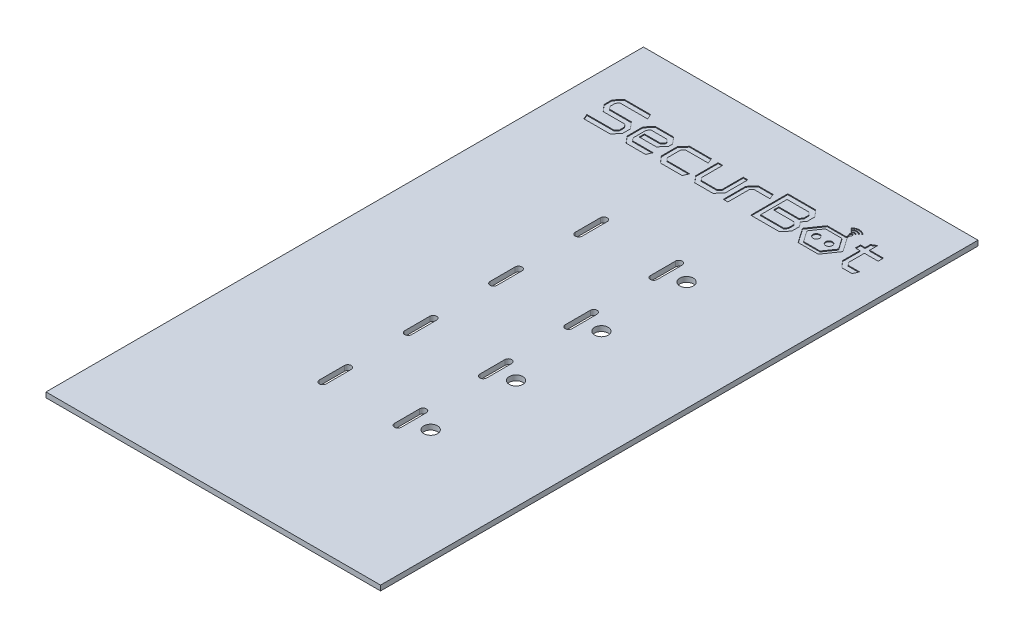
from build123d import *

# Parameters (mm, degrees)
SKETCH1_W                 = 196
SKETCH1_H                 = 350
BOSS_EXTRUDE1_DEPTH       = 3
F_8_0MM_DOWEL_HOLE1_D     = 8
F_4_0MM_DOWEL_SLOT1_DEPTH = 3
CUT_EXTRUDE2_DEPTH        = 0.5


# Read off the part's stored shape, not the designer's step: Ø4.0mm Dowel Slot1
with BuildPart() as part:
    # Sketch1 → Boss-Extrude1 (new body)
    with BuildSketch(Plane(origin=(0, 0, 0), x_dir=(1, 0, 0), z_dir=(0, 1, 0))):
        with Locations((98, 175)):
            Rectangle(SKETCH1_W, SKETCH1_H)
    extrude(amount=BOSS_EXTRUDE1_DEPTH)

    # Ø8.0mm Dowel Hole1 (through all)
    with Locations(Plane(origin=(0, 0, 0), x_dir=(-1, 0, 0), z_dir=(0, -1, 0))):
        with Locations((-131.875, 93.5), (-131.875, 143.5), (-131.875, 193.506698386), (-131.875, 243.405851075)):
            Hole(F_8_0MM_DOWEL_HOLE1_D / 2)

    # Ø4.0mm Dowel Slot1 outline → Ø4.0mm Dowel Slot1 (cut)
    with BuildSketch(Plane(origin=(0, 0, 0), x_dir=(1, 0, 0), z_dir=(0, 1, 0))):
        with BuildLine():
            ThreePointArc((78, 250.755851075), (76, 252.755851075), (74, 250.755851075))
            Line((74, 250.755851075), (74, 236.055851075))
            ThreePointArc((74, 236.055851075), (76, 234.055851075), (78, 236.055851075))
            Line((78, 236.055851075), (78, 250.755851075))
        make_face()
        with BuildLine():
            Line((78, 186.156698386), (78, 200.856698386))
            ThreePointArc((78, 200.856698386), (76, 202.856698386), (74, 200.856698386))
            Line((74, 200.856698386), (74, 186.156698386))
            ThreePointArc((74, 186.156698386), (76, 184.156698386), (78, 186.156698386))
        make_face()
        with BuildLine():
            Line((78, 136.15), (78, 150.85))
            ThreePointArc((78, 150.85), (76, 152.85), (74, 150.85))
            Line((74, 150.85), (74, 136.15))
            ThreePointArc((74, 136.15), (76, 134.15), (78, 136.15))
        make_face()
        with BuildLine():
            Line((78, 86.15), (78, 100.85))
            ThreePointArc((78, 100.85), (76, 102.85), (74, 100.85))
            Line((74, 100.85), (74, 86.15))
            ThreePointArc((74, 86.15), (76, 84.15), (78, 86.15))
        make_face()
        with BuildLine():
            ThreePointArc((122, 250.755851075), (120, 252.755851075), (118, 250.755851075))
            Line((118, 250.755851075), (118, 236.055851075))
            ThreePointArc((118, 236.055851075), (120, 234.055851075), (122, 236.055851075))
            Line((122, 236.055851075), (122, 250.755851075))
        make_face()
        with BuildLine():
            Line((122, 186.156698386), (122, 200.856698386))
            ThreePointArc((122, 200.856698386), (120, 202.856698386), (118, 200.856698386))
            Line((118, 200.856698386), (118, 186.156698386))
            ThreePointArc((118, 186.156698386), (120, 184.156698386), (122, 186.156698386))
        make_face()
        with BuildLine():
            Line((122, 136.15), (122, 150.85))
            ThreePointArc((122, 150.85), (120, 152.85), (118, 150.85))
            Line((118, 150.85), (118, 136.15))
            ThreePointArc((118, 136.15), (120, 134.15), (122, 136.15))
        make_face()
        with BuildLine():
            Line((122, 86.15), (122, 100.85))
            ThreePointArc((122, 100.85), (120, 102.85), (118, 100.85))
            Line((118, 100.85), (118, 86.15))
            ThreePointArc((118, 86.15), (120, 84.15), (122, 86.15))
        make_face()
    extrude(amount=F_4_0MM_DOWEL_SLOT1_DEPTH, mode=Mode.SUBTRACT)

    # Sketch14 → Cut-Extrude2 (cut)
    # profile 1 of 13: a face of its own
    with BuildSketch(Plane(origin=(0, 3, 0), x_dir=(1, 0, 0), z_dir=(0, 1, 0))):
        with BuildLine():
            add(Edge.make_bspline(
                [(37.59562496, 299.8477736), (37.51704376, 299.7545556), (36.76218752, 298.87814336), (35.91816664, 297.90018832)],
                knots=[0, 0, 0, 0, 1, 1, 1, 1], degree=3))
            Line((35.91816664, 297.90018832), (34.38358336, 296.12208888))
            Line((34.38358336, 296.12208888), (26.67891648, 296.121602))
            Line((26.67891648, 296.121602), (18.97424976, 296.1211152))
            Line((18.97424976, 296.1211152), (18.32124032, 297.63493824))
            add(Edge.make_bspline(
                [(18.32124032, 297.63493824), (17.96208496, 298.46755024), (17.66332104, 299.16755312), (17.65732056, 299.19049992)],
                knots=[0, 0, 0, 0, 1, 1, 1, 1], degree=3))
            add(Edge.make_bspline(
                [(17.65732056, 299.19049992), (17.64647936, 299.23195688), (17.69749104, 299.23225536), (25.68565328, 299.23754072)],
                knots=[0, 0, 0, 0, 1, 1, 1, 1], degree=3))
            Line((25.68565328, 299.23754072), (33.72489568, 299.24285984))
            Line((33.72489568, 299.24285984), (34.38630744, 300.00485984))
            Line((34.38630744, 300.00485984), (35.04771928, 300.76685984))
            Line((35.04771928, 300.76685984), (35.04854472, 302.32261032))
            Line((35.04854472, 302.32261032), (35.04937024, 303.87836032))
            Line((35.04937024, 303.87836032), (34.37780056, 304.65596248))
            Line((34.37780056, 304.65596248), (33.70625, 305.43356464))
            Line((33.70625, 305.43356464), (27.3432084, 305.43383768))
            Line((27.3432084, 305.43383768), (20.98016824, 305.43411072))
            Line((20.98016824, 305.43411072), (19.30516736, 307.37372248))
            Line((19.30516736, 307.37372248), (17.63016648, 309.31333416))
            Line((17.63016648, 309.31333416), (17.63016648, 311.6336724))
            Line((17.63016648, 311.6336724), (17.63016648, 313.95401048))
            Line((17.63016648, 313.95401048), (19.30646, 315.89592264))
            Line((19.30646, 315.89592264), (20.98275376, 317.83783472))
            Line((20.98275376, 317.83783472), (28.68819976, 317.83251448))
            Line((28.68819976, 317.83251448), (36.39364832, 317.82719408))
            Line((36.39364832, 317.82719408), (37.05548976, 316.29440568))
            add(Edge.make_bspline(
                [(37.05548976, 316.29440568), (37.41950352, 315.451372), (37.71733336, 314.75366576), (37.71733336, 314.74394728)],
                knots=[0, 0, 0, 0, 1, 1, 1, 1], degree=3))
            add(Edge.make_bspline(
                [(37.71733336, 314.74394728), (37.71733336, 314.73422888), (34.10021456, 314.72591456), (29.6792908, 314.72547096)],
                knots=[0, 0, 0, 0, 1, 1, 1, 1], degree=3))
            Line((29.6792908, 314.72547096), (21.64124976, 314.72466448))
            Line((21.64124976, 314.72466448), (20.98024784, 313.95817904))
            Line((20.98024784, 313.95817904), (20.3192456, 313.19169384))
            Line((20.3192456, 313.19169384), (20.3187884, 311.63587232))
            Line((20.3187884, 311.63587232), (20.3183312, 310.08005096))
            Line((20.3183312, 310.08005096), (20.98906776, 309.30224728))
            Line((20.98906776, 309.30224728), (21.65980424, 308.52444384))
            Line((21.65980424, 308.52444384), (28.0228404, 308.52444384))
            Line((28.0228404, 308.52444384), (34.38587568, 308.52444384))
            Line((34.38587568, 308.52444384), (36.06218888, 306.58247664))
            Line((36.06218888, 306.58247664), (37.7385, 304.64050952))
            Line((37.7385, 304.64050952), (37.7385, 302.32888448))
            Line((37.7385, 302.32888448), (37.7385, 300.01725928))
            Line((37.7385, 300.01725928), (37.59562496, 299.8477736))
        make_face()
    # profile 2 of 13: a face of its own
    with BuildSketch(Plane(origin=(0, 3, 0), x_dir=(1, 0, 0), z_dir=(0, 1, 0))):
        with BuildLine():
            add(Edge.make_bspline(
                [(56.44497344, 299.19474592), (56.43957592, 299.17410416), (56.14080848, 298.47421568), (55.78104712, 297.6394404)],
                knots=[0, 0, 0, 0, 1, 1, 1, 1], degree=3))
            Line((55.78104712, 297.6394404), (55.1269336, 296.12166768))
            Line((55.1269336, 296.12166768), (49.43294576, 296.12122312))
            Line((49.43294576, 296.12122312), (43.73895576, 296.12077864))
            Line((43.73895576, 296.12077864), (42.06175568, 298.06281816))
            Line((42.06175568, 298.06281816), (40.38457248, 300.00485984))
            Line((40.38457248, 300.00485984), (40.38436088, 304.6528768))
            Line((40.38436088, 304.6528768), (40.3841492, 309.30089328))
            Line((40.3841492, 309.30089328), (42.05964328, 311.24100176))
            Line((42.05964328, 311.24100176), (43.73513728, 313.18111032))
            Line((43.73513728, 313.18111032), (49.09671744, 313.18111032))
            Line((49.09671744, 313.18111032), (54.45829768, 313.18111032))
            Line((54.45829768, 313.18111032), (56.13130672, 311.243466))
            Line((56.13130672, 311.243466), (57.80431584, 309.30582168))
            Line((57.80431584, 309.30582168), (57.80431584, 308.14361272))
            Line((57.80431584, 308.14361272), (57.80431584, 306.9814036))
            Line((57.80431584, 306.9814036), (56.1313364, 305.0435904))
            Line((56.1313364, 305.0435904), (54.4585432, 303.10577696))
            Line((54.4585432, 303.10577696), (49.43227056, 303.10577696))
            Line((49.43227056, 303.10577696), (44.406, 303.10577696))
            Line((44.406, 303.10577696), (44.406, 304.6509436))
            Line((44.406, 304.6509436), (44.406, 306.19611032))
            Line((44.406, 306.19611032), (49.0916608, 306.19611032))
            Line((49.0916608, 306.19611032), (53.77732152, 306.19611032))
            Line((53.77732152, 306.19611032), (54.44682744, 306.97167072))
            Line((54.44682744, 306.97167072), (55.11633336, 307.74723112))
            Line((55.11633336, 307.74723112), (55.11633336, 308.14323088))
            Line((55.11633336, 308.14323088), (55.11633336, 308.53923064))
            Line((55.11633336, 308.53923064), (54.4475852, 309.31500384))
            Line((54.4475852, 309.31500384), (53.7788392, 310.09077696))
            Line((53.7788392, 310.09077696), (49.09686984, 310.09077696))
            Line((49.09686984, 310.09077696), (44.41489848, 310.09077696))
            Line((44.41489848, 310.09077696), (43.743822, 309.31290192))
            Line((43.743822, 309.31290192), (43.07274768, 308.53502696))
            Line((43.07274768, 308.53502696), (43.0732768, 304.6509436))
            Line((43.0732768, 304.6509436), (43.073806, 300.76685984))
            Line((43.073806, 300.76685984), (43.73461872, 300.00049952))
            Line((43.73461872, 300.00049952), (44.3954336, 299.2341392))
            Line((44.3954336, 299.2341392), (50.42510992, 299.23320784))
            add(Edge.make_bspline(
                [(50.42510992, 299.23320784), (56.18691792, 299.23231888), (56.4543524, 299.23060864), (56.44497344, 299.19474592)],
                knots=[0, 0, 0, 0, 1, 1, 1, 1], degree=3))
        make_face()
    # profile 3 of 13: a face of its own
    with BuildSketch(Plane(origin=(0, 3, 0), x_dir=(1, 0, 0), z_dir=(0, 1, 0))):
        with BuildLine():
            add(Edge.make_bspline(
                [(77.8916688, 299.20581816), (77.8916688, 299.19126608), (77.59489728, 298.49117864), (77.2319588, 297.65006816)],
                knots=[0, 0, 0, 0, 1, 1, 1, 1], degree=3))
            Line((77.2319588, 297.65006816), (76.57207528, 296.12077656))
            Line((76.57207528, 296.12077656), (70.20958696, 296.12077656))
            Line((70.20958696, 296.12077656), (63.84709864, 296.12077656))
            Line((63.84709864, 296.12077656), (62.17008904, 298.06281816))
            Line((62.17008904, 298.06281816), (60.49290584, 300.00485984))
            Line((60.49290584, 300.00485984), (60.49269416, 304.6528768))
            Line((60.49269416, 304.6528768), (60.49248248, 309.30089328))
            Line((60.49248248, 309.30089328), (62.16797656, 311.24100176))
            Line((62.16797656, 311.24100176), (63.84347064, 313.18111032))
            Line((63.84347064, 313.18111032), (70.20860904, 313.18111032))
            Line((70.20860904, 313.18111032), (76.57374536, 313.18111032))
            Line((76.57374536, 313.18111032), (76.90937032, 312.40323528))
            add(Edge.make_bspline(
                [(76.90937032, 312.40323528), (77.09396272, 311.975404), (77.39328264, 311.28246032), (77.5745244, 310.86336032)],
                knots=[0, 0, 0, 0, 1, 1, 1, 1], degree=3))
            Line((77.5745244, 310.86336032), (77.90405128, 310.10136032))
            Line((77.90405128, 310.10136032), (71.20911712, 310.09077696))
            Line((71.20911712, 310.09077696), (64.51418304, 310.0801936))
            Line((64.51418304, 310.0801936), (63.8475156, 309.30761032))
            Line((63.8475156, 309.30761032), (63.18084816, 308.53502696))
            Line((63.18084816, 308.53502696), (63.18139848, 304.6509436))
            Line((63.18139848, 304.6509436), (63.1819488, 300.76685984))
            Line((63.1819488, 300.76685984), (63.84276152, 300.00049952))
            Line((63.84276152, 300.00049952), (64.5035764, 299.2341392))
            Line((64.5035764, 299.2341392), (71.19753472, 299.23320784))
            add(Edge.make_bspline(
                [(71.19753472, 299.23320784), (76.53799696, 299.23246704), (77.89152904, 299.22692768), (77.8916688, 299.20581816)],
                knots=[0, 0, 0, 0, 1, 1, 1, 1], degree=3))
        make_face()
    # profile 4 of 13: a face of its own
    with BuildSketch(Plane(origin=(0, 3, 0), x_dir=(1, 0, 0), z_dir=(0, 1, 0))):
        Polygon((83.93363024, 296.12077656), (82.25673072, 298.06260656), (80.57983336, 300.0044196), (80.57983336, 306.5927656), (80.57983336, 313.18111032), (81.92391664, 313.18111032), (83.268, 313.18111032), (83.268, 306.97928144), (83.268, 300.77745168), (83.9366592, 300.00481752), (84.60532056, 299.23218336), (89.29669632, 299.2375216), (93.98807424, 299.24285984), (94.64898008, 300.00485984), (95.309886, 300.76685984), (95.31085968, 306.97398528), (95.31183336, 313.18111032), (96.65591664, 313.18111032), (98, 313.18111032), (98, 306.59055536), (98, 300), (96.32499912, 298.06038824), (94.64999824, 296.12077656), (89.2918132, 296.12077656), align=None)
    # profile 5 of 13: a face of its own
    with BuildSketch(Plane(origin=(0, 3, 0), x_dir=(1, 0, 0), z_dir=(0, 1, 0))):
        Polygon((100.66719896, 296.12077656), (100.667, 302.71083512), (100.667, 309.30089328), (102.34253848, 311.24105192), (104.01807704, 313.1812108), (108.37610744, 313.17586904), (112.73413784, 313.17052696), (113.3968556, 311.6359436), (114.05957544, 310.10136032), (109.37413696, 310.09077696), (104.68870056, 310.0801936), (104.02203304, 309.30761032), (103.3553656, 308.53502696), (103.3553656, 302.32790192), (103.3553656, 296.12077656), (102.01128232, 296.12077656), align=None)
    # profile 6 of 13: a face of its own
    with BuildSketch(Plane(origin=(0, 3, 0), x_dir=(1, 0, 0), z_dir=(0, 1, 0))):
        with BuildLine():
            add(Edge.make_bspline(
                [(136.69795832, 299.84777776), (136.61937704, 299.754564), (135.8645208, 298.87812856), (135.0205, 297.90014816)],
                knots=[0, 0, 0, 0, 1, 1, 1, 1], degree=3))
            Line((135.0205, 297.90014816), (133.48591664, 296.122))
            Line((133.48591664, 296.122), (125.10920832, 296.12138616))
            Line((125.10920832, 296.12138616), (116.7325, 296.12077232))
            Line((116.7325, 296.12077232), (116.7325, 306.97927696))
            Line((116.7325, 306.97927696), (116.7325, 317.83777696))
            Line((116.7325, 317.83777696), (124.90812496, 317.8372076))
            Line((124.90812496, 317.8372076), (133.08375, 317.83663816))
            Line((133.08375, 317.83663816), (134.61833336, 316.05853048))
            add(Edge.make_bspline(
                [(134.61833336, 316.05853048), (135.46235416, 315.0805712), (136.2172104, 314.2041192), (136.29579168, 314.11085952)],
                knots=[0, 0, 0, 0, 1, 1, 1, 1], degree=3))
            Line((136.29579168, 314.11085952), (136.43866664, 313.94129632))
            Line((136.43866664, 313.94129632), (136.43866664, 311.6293828))
            Line((136.43866664, 311.6293828), (136.43866664, 309.31746928))
            Line((136.43866664, 309.31746928), (135.53908336, 308.276154))
            add(Edge.make_bspline(
                [(135.53908336, 308.276154), (135.04431248, 307.70343072), (134.6395, 307.22462928), (134.6395, 307.21215136)],
                knots=[0, 0, 0, 0, 1, 1, 1, 1], degree=3))
            add(Edge.make_bspline(
                [(134.6395, 307.21215136), (134.6395, 307.1996732), (135.1348, 306.61607304), (135.74016664, 305.91526208)],
                knots=[0, 0, 0, 0, 1, 1, 1, 1], degree=3))
            Line((135.74016664, 305.91526208), (136.84083336, 304.64106024))
            Line((136.84083336, 304.64106024), (136.84083336, 302.32916096))
            Line((136.84083336, 302.32916096), (136.84083336, 300.01726144))
            Line((136.84083336, 300.01726144), (136.69795832, 299.84777776))
        make_face()
        Polygon((132.81177528, 299.23227656), (133.48222096, 300.00841584), (134.15266664, 300.7845552), (134.15266664, 302.3331936), (134.15266664, 303.88183208), (133.48222096, 304.6579712), (132.81177528, 305.43411032), (126.78297096, 305.43411032), (120.75416664, 305.43411032), (120.75416664, 306.98986032), (120.75416664, 308.54561032), (126.5819448, 308.54561032), (132.40972504, 308.54561032), (133.08011144, 309.31948608), (133.7505, 310.09336184), (133.7505, 311.6359436), (133.7505, 313.17852544), (133.08011144, 313.9524012), (132.40972504, 314.72627696), (125.9151948, 314.72627696), (119.42066664, 314.72627696), (119.42066664, 306.97927696), (119.42066664, 299.23227656), (126.11622096, 299.23227656), align=None, mode=Mode.SUBTRACT)
    # profile 7 of 13: a face of its own
    with BuildSketch(Plane(origin=(0, 3, 0), x_dir=(1, 0, 0), z_dir=(0, 1, 0))):
        with BuildLine():
            add(Edge.make_bspline(
                [(156.88566664, 315.5838724), (156.88566664, 315.31487176), (156.7212292, 315.01373232), (156.49828064, 314.87444528)],
                knots=[0, 0, 0, 0, 1, 1, 1, 1], degree=3))
            Line((156.49828064, 314.87444528), (156.3797008, 314.800362))
            Line((156.3797008, 314.800362), (156.3786848, 313.95268544))
            Line((156.3786848, 313.95268544), (156.3776688, 313.10500896))
            Line((156.3776688, 313.10500896), (159.31934224, 308.8673972))
            Line((159.31934224, 308.8673972), (162.26101784, 304.62978544))
            Line((162.26101784, 304.62978544), (159.30346728, 300.36579808))
            Line((159.30346728, 300.36579808), (156.3459188, 296.10181328))
            Line((156.3459188, 296.10181328), (150.41925208, 296.10181328))
            Line((150.41925208, 296.10181328), (144.49258544, 296.10181328))
            Line((144.49258544, 296.10181328), (141.53505392, 300.36576848))
            Line((141.53505392, 300.36576848), (138.57752232, 304.62977296))
            Line((138.57752232, 304.62977296), (141.53505392, 308.89374568))
            Line((141.53505392, 308.89374568), (144.49258336, 313.15771856))
            Line((144.49258336, 313.15771856), (150.09645832, 313.15883192))
            Line((150.09645832, 313.15883192), (155.70033336, 313.15994528))
            Line((155.70033336, 313.15994528), (155.70033336, 313.9708096))
            Line((155.70033336, 313.9708096), (155.70033336, 314.78167392))
            Line((155.70033336, 314.78167392), (155.57002712, 314.86510128))
            add(Edge.make_bspline(
                [(155.57002712, 314.86510128), (155.33419864, 315.0160884), (155.17116664, 315.3097416), (155.17116664, 315.58352864)],
                knots=[0, 0, 0, 0, 1, 1, 1, 1], degree=3))
            add(Edge.make_bspline(
                [(155.17116664, 315.58352864), (155.17116664, 316.1417948), (155.73417456, 316.5632064), (156.2647256, 316.4020568)],
                knots=[0, 0, 0, 0, 1, 1, 1, 1], degree=3))
            add(Edge.make_bspline(
                [(156.2647256, 316.4020568), (156.62615272, 316.29227624), (156.88566664, 315.95032856), (156.88566664, 315.5838724)],
                knots=[0, 0, 0, 0, 1, 1, 1, 1], degree=3))
        make_face()
        with BuildLine():
            add(Edge.make_bspline(
                [(141.16701424, 304.61851648), (141.17384688, 304.60012736), (144.84094648, 299.30947768), (145.4175624, 298.48610496)],
                knots=[0, 0, 0, 0, 1, 1, 1, 1], degree=3))
            Line((145.4175624, 298.48610496), (145.6065892, 298.21618552))
            Line((145.6065892, 298.21618552), (150.42403368, 298.2215216))
            Line((150.42403368, 298.2215216), (155.241476, 298.22685984))
            Line((155.241476, 298.22685984), (157.46044112, 301.42302656))
            add(Edge.make_bspline(
                [(157.46044112, 301.42302656), (158.68087304, 303.18091864), (159.67939784, 304.62395616), (159.67938512, 304.62977696)],
                knots=[0, 0, 0, 0, 1, 1, 1, 1], degree=3))
            add(Edge.make_bspline(
                [(159.67938512, 304.62977696), (159.67937456, 304.63559776), (158.68083072, 306.07863528), (157.46040304, 307.83652696)],
                knots=[0, 0, 0, 0, 1, 1, 1, 1], degree=3))
            Line((157.46040304, 307.83652696), (155.24144, 311.0326936))
            Line((155.24144, 311.0326936), (150.41925, 311.0326936))
            Line((150.41925, 311.0326936), (145.59706, 311.0326936))
            Line((145.59706, 311.0326936), (143.3779784, 307.83652696))
            add(Edge.make_bspline(
                [(143.3779784, 307.83652696), (142.15748304, 306.07863528), (141.16255016, 304.63053048), (141.16701424, 304.61851648)],
                knots=[0, 0, 0, 0, 1, 1, 1, 1], degree=3))
        make_face(mode=Mode.SUBTRACT)
    # profile 8 of 13: a face of its own
    with BuildSketch(Plane(origin=(0, 3, 0), x_dir=(1, 0, 0), z_dir=(0, 1, 0))):
        with BuildLine():
            add(Edge.make_bspline(
                [(152.83682832, 318.66327696), (152.83379512, 318.66327696), (152.75097208, 318.74404024), (152.6527736, 318.84275104)],
                knots=[0, 0, 0, 0, 1, 1, 1, 1], degree=3))
            Line((152.6527736, 318.84275104), (152.47423272, 319.02222512))
            Line((152.47423272, 319.02222512), (152.53682472, 319.08844928))
            add(Edge.make_bspline(
                [(152.53682472, 319.08844928), (152.57125016, 319.1248724), (152.68990416, 319.23075528), (152.8005, 319.32374424)],
                knots=[0, 0, 0, 0, 1, 1, 1, 1], degree=3))
            add(Edge.make_bspline(
                [(152.8005, 319.32374424), (153.69229824, 320.07356944), (154.87059368, 320.5046328), (156.02841664, 320.5046328)],
                knots=[0, 0, 0, 0, 1, 1, 1, 1], degree=3))
            add(Edge.make_bspline(
                [(156.02841664, 320.5046328), (157.1859476, 320.5046328), (158.36166912, 320.07465104), (159.25633336, 319.32412904)],
                knots=[0, 0, 0, 0, 1, 1, 1, 1], degree=3))
            add(Edge.make_bspline(
                [(159.25633336, 319.32412904), (159.36692912, 319.23135176), (159.47589304, 319.13482736), (159.49847368, 319.10963072)],
                knots=[0, 0, 0, 0, 1, 1, 1, 1], degree=3))
            Line((159.49847368, 319.10963072), (159.53953272, 319.06381848))
            Line((159.53953272, 319.06381848), (159.36135808, 318.8847144))
            add(Edge.make_bspline(
                [(159.36135808, 318.8847144), (159.2633628, 318.78620704), (159.17821136, 318.70594856), (159.17213448, 318.70636168)],
                knots=[0, 0, 0, 0, 1, 1, 1, 1], degree=3))
            add(Edge.make_bspline(
                [(159.17213448, 318.70636168), (159.16605536, 318.70677448), (159.06256944, 318.79210488), (158.94216496, 318.89598352)],
                knots=[0, 0, 0, 0, 1, 1, 1, 1], degree=3))
            add(Edge.make_bspline(
                [(158.94216496, 318.89598352), (157.90081152, 319.7944052), (156.51290688, 320.15739784), (155.15, 319.88778744)],
                knots=[0, 0, 0, 0, 1, 1, 1, 1], degree=3))
            add(Edge.make_bspline(
                [(155.15, 319.88778744), (154.37677952, 319.73482848), (153.70185712, 319.4028636), (153.08507528, 318.87214264)],
                knots=[0, 0, 0, 0, 1, 1, 1, 1], degree=3))
            add(Edge.make_bspline(
                [(153.08507528, 318.87214264), (152.95157072, 318.75726648), (152.83985944, 318.66327696), (152.83682832, 318.66327696)],
                knots=[0, 0, 0, 0, 1, 1, 1, 1], degree=3))
        make_face()
    # profile 9 of 13: a face of its own
    with BuildSketch(Plane(origin=(0, 3, 0), x_dir=(1, 0, 0), z_dir=(0, 1, 0))):
        with BuildLine():
            add(Edge.make_bspline(
                [(155.404, 318.58125736), (154.83766256, 318.45965784), (154.37899992, 318.23265912), (153.95199208, 317.86264016)],
                knots=[0, 0, 0, 0, 1, 1, 1, 1], degree=3))
            Line((153.95199208, 317.86264016), (153.78056536, 317.7140936))
            Line((153.78056536, 317.7140936), (153.59582688, 317.8996916))
            Line((153.59582688, 317.8996916), (153.41109056, 318.08528976))
            Line((153.41109056, 318.08528976), (153.5450036, 318.20678816))
            add(Edge.make_bspline(
                [(153.5450036, 318.20678816), (154.13784808, 318.7446696), (154.84000568, 319.05957072), (155.64741664, 319.14967128)],
                knots=[0, 0, 0, 0, 1, 1, 1, 1], degree=3))
            add(Edge.make_bspline(
                [(155.64741664, 319.14967128), (156.59567064, 319.25548896), (157.58893336, 318.95331744), (158.35452328, 318.32611184)],
                knots=[0, 0, 0, 0, 1, 1, 1, 1], degree=3))
            add(Edge.make_bspline(
                [(158.35452328, 318.32611184), (158.43724048, 318.25834656), (158.52345864, 318.18222232), (158.54612184, 318.1569468)],
                knots=[0, 0, 0, 0, 1, 1, 1, 1], degree=3))
            Line((158.54612184, 318.1569468), (158.58732904, 318.11099096))
            Line((158.58732904, 318.11099096), (158.4042988, 317.92796176))
            Line((158.4042988, 317.92796176), (158.22127064, 317.74493232))
            Line((158.22127064, 317.74493232), (158.09670264, 317.85327712))
            add(Edge.make_bspline(
                [(158.09670264, 317.85327712), (157.78397368, 318.12528128), (157.37771968, 318.36057056), (157.01266664, 318.481116)],
                knots=[0, 0, 0, 0, 1, 1, 1, 1], degree=3))
            add(Edge.make_bspline(
                [(157.01266664, 318.481116), (156.6674764, 318.59510248), (156.43956224, 318.6289772), (156.01783336, 318.6289772)],
                knots=[0, 0, 0, 0, 1, 1, 1, 1], degree=3))
            add(Edge.make_bspline(
                [(156.01783336, 318.6289772), (155.69134808, 318.6289772), (155.58930144, 318.62104416), (155.404, 318.58125736)],
                knots=[0, 0, 0, 0, 1, 1, 1, 1], degree=3))
        make_face()
    # profile 10 of 13: a face of its own
    with BuildSketch(Plane(origin=(0, 3, 0), x_dir=(1, 0, 0), z_dir=(0, 1, 0))):
        with BuildLine():
            add(Edge.make_bspline(
                [(154.807644, 316.69477696), (154.80336616, 316.69477696), (154.71664632, 316.77838528), (154.61493208, 316.88057312)],
                knots=[0, 0, 0, 0, 1, 1, 1, 1], degree=3))
            Line((154.61493208, 316.88057312), (154.4299968, 317.0663692))
            Line((154.4299968, 317.0663692), (154.55187232, 317.16946))
            add(Edge.make_bspline(
                [(154.55187232, 317.16946), (154.80955744, 317.38742376), (155.12684152, 317.5517776), (155.46314392, 317.64149824)],
                knots=[0, 0, 0, 0, 1, 1, 1, 1], degree=3))
            add(Edge.make_bspline(
                [(155.46314392, 317.64149824), (155.64352408, 317.68962128), (155.70989216, 317.69630656), (156.00725, 317.69630656)],
                knots=[0, 0, 0, 0, 1, 1, 1, 1], degree=3))
            add(Edge.make_bspline(
                [(156.00725, 317.69630656), (156.30460776, 317.69630656), (156.37097584, 317.68962128), (156.55135608, 317.64149824)],
                knots=[0, 0, 0, 0, 1, 1, 1, 1], degree=3))
            add(Edge.make_bspline(
                [(156.55135608, 317.64149824), (156.79241688, 317.57718672), (157.06422016, 317.45442896), (157.26266192, 317.3202412)],
                knots=[0, 0, 0, 0, 1, 1, 1, 1], degree=3))
            add(Edge.make_bspline(
                [(157.26266192, 317.3202412), (157.41537728, 317.21697384), (157.54183336, 317.10817384), (157.54183336, 317.08004624)],
                knots=[0, 0, 0, 0, 1, 1, 1, 1], degree=3))
            add(Edge.make_bspline(
                [(157.54183336, 317.08004624), (157.54183336, 317.07042432), (157.46149736, 316.98394536), (157.36330944, 316.88787048)],
                knots=[0, 0, 0, 0, 1, 1, 1, 1], degree=3))
            Line((157.36330944, 316.88787048), (157.18478344, 316.71318896))
            Line((157.18478344, 316.71318896), (157.07226776, 316.80476256))
            add(Edge.make_bspline(
                [(157.07226776, 316.80476256), (156.44811352, 317.31273928), (155.50535024, 317.30207784), (154.91262432, 316.78033984)],
                knots=[0, 0, 0, 0, 1, 1, 1, 1], degree=3))
            add(Edge.make_bspline(
                [(154.91262432, 316.78033984), (154.85916368, 316.7332804), (154.81192176, 316.69477696), (154.807644, 316.69477696)],
                knots=[0, 0, 0, 0, 1, 1, 1, 1], degree=3))
        make_face()
    # profile 11 of 13: a face of its own
    with BuildSketch(Plane(origin=(0, 3, 0), x_dir=(1, 0, 0), z_dir=(0, 1, 0))):
        with BuildLine():
            add(Edge.make_bspline(
                [(146.768, 302.6302604), (146.6341208, 302.62594408), (146.49600832, 302.6269372), (146.46108336, 302.63246768)],
                knots=[0, 0, 0, 0, 1, 1, 1, 1], degree=3))
            add(Edge.make_bspline(
                [(146.46108336, 302.63246768), (145.99652368, 302.70603152), (145.63793072, 302.88089488), (145.32157584, 303.18813224)],
                knots=[0, 0, 0, 0, 1, 1, 1, 1], degree=3))
            add(Edge.make_bspline(
                [(145.32157584, 303.18813224), (145.048928, 303.45292384), (144.86509552, 303.77125248), (144.77386504, 304.13656504)],
                knots=[0, 0, 0, 0, 1, 1, 1, 1], degree=3))
            add(Edge.make_bspline(
                [(144.77386504, 304.13656504), (144.73744144, 304.28241544), (144.72734072, 304.3848968), (144.72734072, 304.60861032)],
                knots=[0, 0, 0, 0, 1, 1, 1, 1], degree=3))
            add(Edge.make_bspline(
                [(144.72734072, 304.60861032), (144.72734072, 305.0331804), (144.81860712, 305.3490724), (145.0426288, 305.69989416)],
                knots=[0, 0, 0, 0, 1, 1, 1, 1], degree=3))
            add(Edge.make_bspline(
                [(145.0426288, 305.69989416), (145.15153768, 305.87044712), (145.41427736, 306.13687496), (145.58673488, 306.25163768)],
                knots=[0, 0, 0, 0, 1, 1, 1, 1], degree=3))
            add(Edge.make_bspline(
                [(145.58673488, 306.25163768), (145.9420576, 306.48809072), (146.26882016, 306.58576896), (146.7045, 306.58576896)],
                knots=[0, 0, 0, 0, 1, 1, 1, 1], degree=3))
            add(Edge.make_bspline(
                [(146.7045, 306.58576896), (147.12906944, 306.58576896), (147.44496288, 306.49450312), (147.79578344, 306.27048088)],
                knots=[0, 0, 0, 0, 1, 1, 1, 1], degree=3))
            add(Edge.make_bspline(
                [(147.79578344, 306.27048088), (147.966336, 306.16157176), (148.23276504, 305.89883272), (148.34752648, 305.72637624)],
                knots=[0, 0, 0, 0, 1, 1, 1, 1], degree=3))
            add(Edge.make_bspline(
                [(148.34752648, 305.72637624), (148.58397936, 305.37105248), (148.68165928, 305.04429016), (148.68165928, 304.60861032)],
                knots=[0, 0, 0, 0, 1, 1, 1, 1], degree=3))
            add(Edge.make_bspline(
                [(148.68165928, 304.60861032), (148.68165928, 304.3848968), (148.67155856, 304.28241544), (148.63513496, 304.13656504)],
                knots=[0, 0, 0, 0, 1, 1, 1, 1], degree=3))
            add(Edge.make_bspline(
                [(148.63513496, 304.13656504), (148.54390448, 303.77125248), (148.360072, 303.45292384), (148.08742416, 303.18813224)],
                knots=[0, 0, 0, 0, 1, 1, 1, 1], degree=3))
            add(Edge.make_bspline(
                [(148.08742416, 303.18813224), (147.71460088, 302.82605376), (147.29144528, 302.64713696), (146.768, 302.6302604)],
                knots=[0, 0, 0, 0, 1, 1, 1, 1], degree=3))
        make_face()
    # profile 12 of 13: a face of its own
    with BuildSketch(Plane(origin=(0, 3, 0), x_dir=(1, 0, 0), z_dir=(0, 1, 0))):
        with BuildLine():
            add(Edge.make_bspline(
                [(154.17633336, 302.6302604), (154.04245416, 302.62594408), (153.90434168, 302.6269372), (153.86941664, 302.63246768)],
                knots=[0, 0, 0, 0, 1, 1, 1, 1], degree=3))
            add(Edge.make_bspline(
                [(153.86941664, 302.63246768), (153.40485704, 302.70603152), (153.04626408, 302.88089488), (152.7299092, 303.18813224)],
                knots=[0, 0, 0, 0, 1, 1, 1, 1], degree=3))
            add(Edge.make_bspline(
                [(152.7299092, 303.18813224), (152.45726136, 303.45292384), (152.2734288, 303.77125248), (152.1821984, 304.13656504)],
                knots=[0, 0, 0, 0, 1, 1, 1, 1], degree=3))
            add(Edge.make_bspline(
                [(152.1821984, 304.13656504), (152.1457748, 304.28241544), (152.13567408, 304.3848968), (152.13567408, 304.60861032)],
                knots=[0, 0, 0, 0, 1, 1, 1, 1], degree=3))
            add(Edge.make_bspline(
                [(152.13567408, 304.60861032), (152.13567408, 305.0331804), (152.22694048, 305.3490724), (152.45096216, 305.69989416)],
                knots=[0, 0, 0, 0, 1, 1, 1, 1], degree=3))
            add(Edge.make_bspline(
                [(152.45096216, 305.69989416), (152.55987096, 305.87044712), (152.82261072, 306.13687496), (152.99506824, 306.25163768)],
                knots=[0, 0, 0, 0, 1, 1, 1, 1], degree=3))
            add(Edge.make_bspline(
                [(152.99506824, 306.25163768), (153.35039096, 306.48809072), (153.67715344, 306.58576896), (154.11283336, 306.58576896)],
                knots=[0, 0, 0, 0, 1, 1, 1, 1], degree=3))
            add(Edge.make_bspline(
                [(154.11283336, 306.58576896), (154.5491884, 306.58576896), (154.87480368, 306.48826384), (155.23245048, 306.2505008)],
                knots=[0, 0, 0, 0, 1, 1, 1, 1], degree=3))
            add(Edge.make_bspline(
                [(155.23245048, 306.2505008), (155.40063024, 306.1386944), (155.6685008, 305.865694), (155.77802984, 305.69447168)],
                knots=[0, 0, 0, 0, 1, 1, 1, 1], degree=3))
            add(Edge.make_bspline(
                [(155.77802984, 305.69447168), (155.99832616, 305.35009368), (156.08999264, 305.03102904), (156.08999264, 304.60861032)],
                knots=[0, 0, 0, 0, 1, 1, 1, 1], degree=3))
            add(Edge.make_bspline(
                [(156.08999264, 304.60861032), (156.08999264, 304.3848968), (156.07989184, 304.28241544), (156.04346824, 304.13656504)],
                knots=[0, 0, 0, 0, 1, 1, 1, 1], degree=3))
            add(Edge.make_bspline(
                [(156.04346824, 304.13656504), (155.95223784, 303.77125248), (155.76840536, 303.45292384), (155.49575752, 303.18813224)],
                knots=[0, 0, 0, 0, 1, 1, 1, 1], degree=3))
            add(Edge.make_bspline(
                [(155.49575752, 303.18813224), (155.12293416, 302.82605376), (154.69977864, 302.64713696), (154.17633336, 302.6302604)],
                knots=[0, 0, 0, 0, 1, 1, 1, 1], degree=3))
        make_face()
    # profile 13 of 13: a face of its own
    with BuildSketch(Plane(origin=(0, 3, 0), x_dir=(1, 0, 0), z_dir=(0, 1, 0))):
        with BuildLine():
            add(Edge.make_bspline(
                [(177.41133048, 299.20581824), (177.3930128, 299.159804), (176.13157048, 296.23993848), (176.10367704, 296.17898488)],
                knots=[0, 0, 0, 0, 1, 1, 1, 1], degree=3))
            Line((176.10367704, 296.17898488), (176.0770388, 296.12077656))
            Line((176.0770388, 296.12077656), (173.06469832, 296.12077656))
            Line((173.06469832, 296.12077656), (170.05235776, 296.12077656))
            Line((170.05235776, 296.12077656), (168.37967888, 298.057734))
            Line((168.37967888, 298.057734), (166.707, 299.99469352))
            Line((166.707, 299.99469352), (166.707, 305.04273504))
            Line((166.707, 305.04273504), (166.707, 310.09077696))
            Line((166.707, 310.09077696), (165.36291664, 310.09077696))
            Line((165.36291664, 310.09077696), (164.01883336, 310.09077696))
            Line((164.01883336, 310.09077696), (164.01883336, 311.6359436))
            Line((164.01883336, 311.6359436), (164.01883336, 313.18111032))
            Line((164.01883336, 313.18111032), (165.3627812, 313.18111032))
            Line((165.3627812, 313.18111032), (166.70672696, 313.18111032))
            Line((166.70672696, 313.18111032), (166.71215616, 314.7382952))
            Line((166.71215616, 314.7382952), (166.71758336, 316.29548008))
            Line((166.71758336, 316.29548008), (168.0405, 317.06198896))
            Line((168.0405, 317.06198896), (169.36341664, 317.82849792))
            Line((169.36341664, 317.82849792), (169.374, 315.51009576))
            Line((169.374, 315.51009576), (169.38458336, 313.1916936))
            Line((169.38458336, 313.1916936), (173.40095832, 313.18634736))
            Line((173.40095832, 313.18634736), (177.41733336, 313.18100088))
            Line((177.41733336, 313.18100088), (177.41733336, 311.6359436))
            Line((177.41733336, 311.6359436), (177.41733336, 310.0908864))
            Line((177.41733336, 310.0908864), (173.40095832, 310.08553992))
            Line((173.40095832, 310.08553992), (169.38458336, 310.0801936))
            Line((169.38458336, 310.0801936), (169.37924512, 305.43302696))
            Line((169.37924512, 305.43302696), (169.37390472, 300.78585904))
            Line((169.37390472, 300.78585904), (170.04388264, 300.00906784))
            Line((170.04388264, 300.00906784), (170.71386056, 299.23227656))
            Line((170.71386056, 299.23227656), (174.06786072, 299.23227656))
            add(Edge.make_bspline(
                [(174.06786072, 299.23227656), (176.74256752, 299.23227656), (177.41972936, 299.22691712), (177.41133048, 299.20581824)],
                knots=[0, 0, 0, 0, 1, 1, 1, 1], degree=3))
        make_face()
    extrude(amount=-CUT_EXTRUDE2_DEPTH, mode=Mode.SUBTRACT)


solid = part.part
